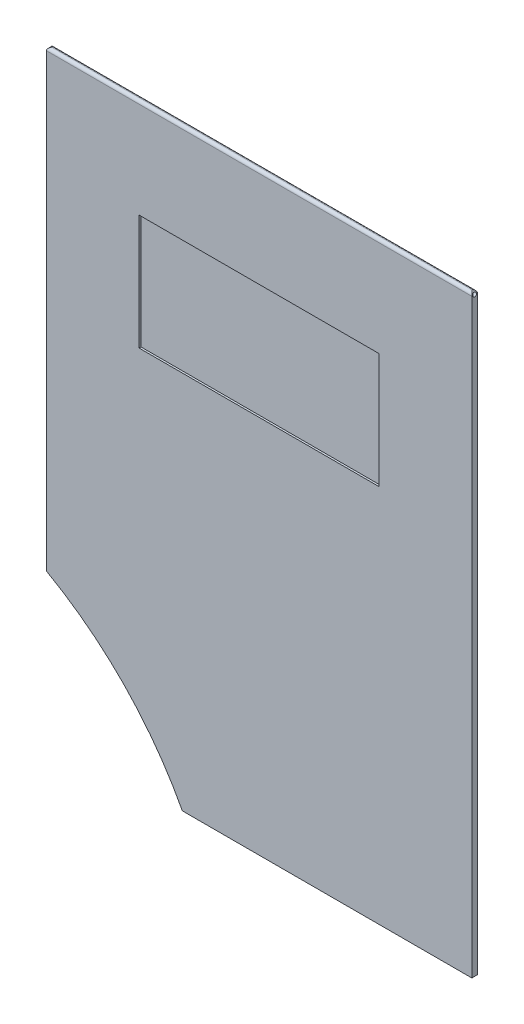
from build123d import *

# Parameters (mm, degrees)
EXTRUDE_1_DEPTH     = 3
SKETCH_3_R          = 1
CUT_EXTRUDE_1_DEPTH = 435.775999416
FILLET_1_R          = 1.5
SKETCH_4_W          = 125
SKETCH_4_H          = 60
CUT_EXTRUDE_2_DEPTH = 1
CUT_EXTRUDE_3_DEPTH = 1


with BuildPart() as part:
    # 草图1 → 凸台-拉伸1 (new body)
    with BuildSketch(Plane.XY):
        with BuildLine():
            Line((-582.293881309, 65.051613642), (-431.491871246, 65.051613642))
            Line((-431.491871246, 65.051613642), (-431.491871246, 374.051613642))
            Line((-431.491871246, 374.051613642), (-653.091871246, 374.051613642))
            Line((-653.091871246, 374.051613642), (-653.091871246, 137.849062601))
            ThreePointArc((-653.091871246, 137.849062601), (-612.452891481, 106.546401187), (-582.293881309, 65.051613642))
        make_face()
    extrude(amount=EXTRUDE_1_DEPTH)

    # 草图3 → 切除-拉伸1 (cut, through all)
    with BuildSketch(Plane(origin=(-431.491871246, 0, 0), x_dir=(0, 0, -1), z_dir=(1, 0, 0))):
        with Locations((-1.5, 372.551613642)):
            Circle(SKETCH_3_R)
    extrude(amount=-CUT_EXTRUDE_1_DEPTH, mode=Mode.SUBTRACT)

    # 圆角1
    # the kernel refuses this fillet: 1.5 mm, written as the material it takes off along each edge
    with BuildSketch(Plane(origin=(-653.091871246, 374.051613642, -3.75), x_dir=(0, -1, 0), z_dir=(0, 0, 1)), Plane(origin=(-431.491871246, 374.051613642, -3.75), x_dir=(-1, 0, 0), z_dir=(0, 0, 1))) as fillet_1_piece_1:
        with BuildLine():
            CenterArc((FILLET_1_R, FILLET_1_R), FILLET_1_R, 180, 90)
            Line((0, FILLET_1_R), (0, 0))
            Line((0, 0), (FILLET_1_R, 0))
        make_face()
    extrude(amount=10.5, mode=Mode.SUBTRACT)
    with BuildSketch(Plane(origin=(-427.741871246, 374.051613642, 3), x_dir=(0, -1, 0), z_dir=(-1, 0, 0))) as fillet_1_piece_2:
        with BuildLine():
            CenterArc((FILLET_1_R, -FILLET_1_R), FILLET_1_R, 90, 90)
            Line((0, -FILLET_1_R), (0, 0))
            Line((0, 0), (FILLET_1_R, 0))
        make_face()
    extrude(amount=229.1, mode=Mode.SUBTRACT)
    with BuildSketch(Plane(origin=(-427.741871246, 374.051613642, 0), x_dir=(0, -1, 0), z_dir=(-1, 0, 0))) as fillet_1_piece_3:
        with BuildLine():
            CenterArc((FILLET_1_R, FILLET_1_R), FILLET_1_R, 180, 90)
            Line((0, FILLET_1_R), (0, 0))
            Line((0, 0), (FILLET_1_R, 0))
        make_face()
    extrude(amount=229.1, mode=Mode.SUBTRACT)

    # 草图4 → 切除-拉伸2 (cut)
    with BuildSketch(Plane(origin=(0, 0, 0), x_dir=(-1, 0, 0), z_dir=(0, 0, -1))):
        with Locations((542.291871246, 292.551613642)):
            Rectangle(SKETCH_4_W, SKETCH_4_H)
    extrude(amount=-CUT_EXTRUDE_2_DEPTH, mode=Mode.SUBTRACT)

    # 草图5 → 切除-拉伸3 (cut)
    with BuildSketch(Plane.XY.offset(3)):
        Polygon((-479.791871246, 322.551613642), (-500.741871246, 322.551613642), (-542.291871246, 292.551613642), (-500.741871246, 262.551613642), (-479.791871246, 262.551613642), align=None)
        Polygon((-500.741871246, 322.551613642), (-583.841871246, 322.551613642), (-542.291871246, 292.551613642), align=None)
        Polygon((-542.291871246, 292.551613642), (-583.841871246, 322.551613642), (-604.791871246, 322.551613642), (-604.791871246, 262.551613642), (-583.841871246, 262.551613642), align=None)
        Polygon((-542.291871246, 292.551613642), (-583.841871246, 262.551613642), (-500.741871246, 262.551613642), align=None)
    extrude(amount=-CUT_EXTRUDE_3_DEPTH, mode=Mode.SUBTRACT)


solid = part.part
